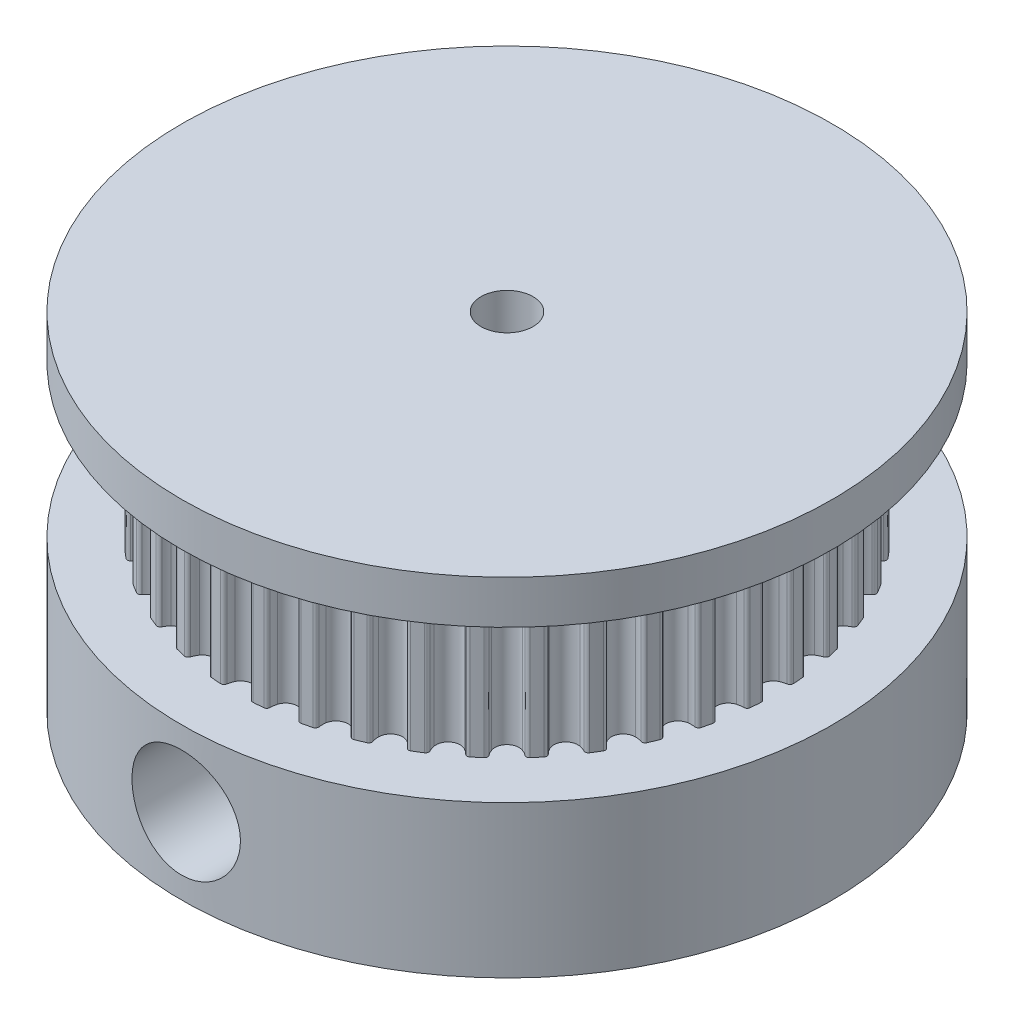
from build123d import *

# Parameters (mm, degrees)
GEAR_DEPTH              = 3.5
SKETCH2_R               = 15
SKETCH2_R_2             = 1.2
BASE_DEPTH              = 7
NUT_PASSTHROUGH_DEPTH   = 3.5
TOP_START               = 2
SKETCH9_R               = 15
TOP_DEPTH               = 2
SHAFT_HOLE_DEPTH        = 24.043437244
SKETCH10_R              = 1.4
SCREW_HOLE_DEPTH        = 24.669600757
SCREW_START             = 5
SKETCH10_3_R            = 2.5
SKETCH10_3_R_2          = 1.4
SCREW_COUNTERBORE_DEPTH = 19.669600928
CHAMFER2_SIZE           = 1.1
SKETCH14_R              = 1
BOSS_EXTRUDE1_DEPTH     = 10.5


with BuildPart() as part:
    # Sketch1 → Gear (new, symmetric)
    with BuildSketch(Plane(origin=(0, 0, 0), x_dir=(1, 0, 0), z_dir=(0, 1, 0))):
        with BuildLine():
            ThreePointArc((1.833722096, 11.57766566), (1.55639111, 11.707003084), (1.389763602, 11.963666129))
            ThreePointArc((1.389763602, 11.963666129), (1.356190139, 12.114322359), (1.346201315, 12.268350606))
            ThreePointArc((1.346201315, 12.268350606), (1.307933069, 12.370317587), (1.210767384, 12.419516709))
            ThreePointArc((1.210767384, 12.419516709), (0.979043623, 12.439928719), (0.746979624, 12.456017597))
            ThreePointArc((0.746979624, 12.456017597), (0.643313772, 12.42262426), (0.589565521, 12.327899134))
            ThreePointArc((0.589565521, 12.327899134), (0.55560435, 12.177329827), (0.498876404, 12.033780472))
            ThreePointArc((0.498876404, 12.033780472), (0.294149412, 11.80634366), (0, 11.721982719))
            ThreePointArc((0, 11.721982719), (-0.294149412, 11.80634366), (-0.498876404, 12.033780472))
            ThreePointArc((-0.498876404, 12.033780472), (-0.55560435, 12.177329827), (-0.589565521, 12.327899134))
            ThreePointArc((-0.589565521, 12.327899134), (-0.643313772, 12.42262426), (-0.746979624, 12.456017597))
            ThreePointArc((-0.746979624, 12.456017597), (-0.979043623, 12.439928719), (-1.210767384, 12.419516709))
            ThreePointArc((-1.210767384, 12.419516709), (-1.307933069, 12.370317587), (-1.346201315, 12.268350606))
            ThreePointArc((-1.346201315, 12.268350606), (-1.356190139, 12.114322359), (-1.389763602, 11.963666129))
            ThreePointArc((-1.389763602, 11.963666129), (-1.55639111, 11.707003084), (-1.833722096, 11.57766566))
            ThreePointArc((-1.833722096, 11.57766566), (-2.137446999, 11.614972872), (-2.375232419, 11.807583202))
            ThreePointArc((-2.375232419, 11.807583202), (-2.453718016, 11.940491021), (-2.510815297, 12.083893872))
            ThreePointArc((-2.510815297, 12.083893872), (-2.578720092, 12.169044696), (-2.686333515, 12.185809993))
            ThreePointArc((-2.686333515, 12.185809993), (-2.913023566, 12.133616388), (-3.138701281, 12.077206101))
            ThreePointArc((-3.138701281, 12.077206101), (-3.226974257, 12.01341264), (-3.248820207, 11.906714569))
            ThreePointArc((-3.248820207, 11.906714569), (-3.234590725, 11.75302007), (-3.244183017, 11.59896662))
            ThreePointArc((-3.244183017, 11.59896662), (-3.368608118, 11.319397239), (-3.622291868, 11.148268049))
            ThreePointArc((-3.622291868, 11.148268049), (-3.928113547, 11.137602905), (-4.193102328, 11.290644046))
            ThreePointArc((-4.193102328, 11.290644046), (-4.291413, 11.409637697), (-4.370240468, 11.542343038))
            ThreePointArc((-4.370240468, 11.542343038), (-4.450629766, 11.615822864), (-4.559540959, 11.615547305))
            ThreePointArc((-4.559540959, 11.615547305), (-4.7752752, 11.528534152), (-4.989349935, 11.437514597))
            ThreePointArc((-4.989349935, 11.437514597), (-5.066556628, 11.360697604), (-5.071442363, 11.251895704))
            ThreePointArc((-5.071442363, 11.251895704), (-5.033344953, 11.10231942), (-5.018719879, 10.948662059))
            ThreePointArc((-5.018719879, 10.948662059), (-5.097878813, 10.653070266), (-5.321668792, 10.444363079))
            ThreePointArc((-5.321668792, 10.444363079), (-5.622056903, 10.38598819), (-5.907724141, 10.495691763))
            ThreePointArc((-5.907724141, 10.495691763), (-6.023439154, 10.597841227), (-6.122055814, 10.716581412))
            ThreePointArc((-6.122055814, 10.716581412), (-6.212950164, 10.776580923), (-6.320477372, 10.759271292))
            ThreePointArc((-6.320477372, 10.759271292), (-6.519943711, 10.639581145), (-6.717144235, 10.516193525))
            ThreePointArc((-6.717144235, 10.516193525), (-6.781383561, 10.428244489), (-6.769188777, 10.320017823))
            ThreePointArc((-6.769188777, 10.320017823), (-6.708161524, 10.178242819), (-6.669679201, 10.028765101))
            ThreePointArc((-6.669679201, 10.028765101), (-6.701622814, 9.724429349), (-6.89000857, 9.483283227))
            ThreePointArc((-6.89000857, 9.483283227), (-7.17756656, 9.378635976), (-7.47687818, 9.442300715))
            ThreePointArc((-7.47687818, 9.442300715), (-7.607148246, 9.525090733), (-7.723125829, 9.626941986))
            ThreePointArc((-7.723125829, 9.626941986), (-7.822287109, 9.671983794), (-7.925782656, 9.638066311))
            ThreePointArc((-7.925782656, 9.638066311), (-8.10406957, 9.488646339), (-8.279540152, 9.335928867))
            ThreePointArc((-8.279540152, 9.335928867), (-8.329230324, 9.239013385), (-8.300255298, 9.134026853))
            ThreePointArc((-8.300255298, 9.134026853), (-8.217800894, 9.003544101), (-8.156408886, 8.861926663))
            ThreePointArc((-8.156408886, 8.861926663), (-8.140350619, 8.556340707), (-8.288693469, 8.288693469))
            ThreePointArc((-8.288693469, 8.288693469), (-8.556340707, 8.140350619), (-8.861926663, 8.156408886))
            ThreePointArc((-8.861926663, 8.156408886), (-9.003544101, 8.217800894), (-9.134026853, 8.300255298))
            ThreePointArc((-9.134026853, 8.300255298), (-9.239013385, 8.329230324), (-9.335928867, 8.279540152))
            ThreePointArc((-9.335928867, 8.279540152), (-9.488646339, 8.10406957), (-9.638066311, 7.925782656))
            ThreePointArc((-9.638066311, 7.925782656), (-9.671983794, 7.822287109), (-9.626941986, 7.723125829))
            ThreePointArc((-9.626941986, 7.723125829), (-9.525090733, 7.607148246), (-9.442300715, 7.47687818))
            ThreePointArc((-9.442300715, 7.47687818), (-9.378635976, 7.17756656), (-9.483283227, 6.89000857))
            ThreePointArc((-9.483283227, 6.89000857), (-9.724429349, 6.701622814), (-10.028765101, 6.669679201))
            ThreePointArc((-10.028765101, 6.669679201), (-10.178242819, 6.708161524), (-10.320017823, 6.769188777))
            ThreePointArc((-10.320017823, 6.769188777), (-10.428244489, 6.781383561), (-10.516193525, 6.717144235))
            ThreePointArc((-10.516193525, 6.717144235), (-10.639581145, 6.519943711), (-10.759271292, 6.320477372))
            ThreePointArc((-10.759271292, 6.320477372), (-10.776580923, 6.212950164), (-10.716581412, 6.122055814))
            ThreePointArc((-10.716581412, 6.122055814), (-10.597841227, 6.023439154), (-10.495691763, 5.907724141))
            ThreePointArc((-10.495691763, 5.907724141), (-10.38598819, 5.622056903), (-10.444363079, 5.321668792))
            ThreePointArc((-10.444363079, 5.321668792), (-10.653070266, 5.097878813), (-10.948662059, 5.018719879))
            ThreePointArc((-10.948662059, 5.018719879), (-11.10231942, 5.033344953), (-11.251895704, 5.071442363))
            ThreePointArc((-11.251895704, 5.071442363), (-11.360697604, 5.066556628), (-11.437514597, 4.989349935))
            ThreePointArc((-11.437514597, 4.989349935), (-11.528534152, 4.7752752), (-11.615547305, 4.559540959))
            ThreePointArc((-11.615547305, 4.559540959), (-11.615822864, 4.450629766), (-11.542343038, 4.370240468))
            ThreePointArc((-11.542343038, 4.370240468), (-11.409637697, 4.291413), (-11.290644046, 4.193102328))
            ThreePointArc((-11.290644046, 4.193102328), (-11.137602905, 3.928113547), (-11.148268049, 3.622291868))
            ThreePointArc((-11.148268049, 3.622291868), (-11.319397239, 3.368608118), (-11.59896662, 3.244183017))
            ThreePointArc((-11.59896662, 3.244183017), (-11.75302007, 3.234590725), (-11.906714569, 3.248820207))
            ThreePointArc((-11.906714569, 3.248820207), (-12.01341264, 3.226974257), (-12.077206101, 3.138701281))
            ThreePointArc((-12.077206101, 3.138701281), (-12.133616388, 2.913023566), (-12.185809993, 2.686333515))
            ThreePointArc((-12.185809993, 2.686333515), (-12.169044696, 2.578720092), (-12.083893872, 2.510815297))
            ThreePointArc((-12.083893872, 2.510815297), (-11.940491021, 2.453718016), (-11.807583202, 2.375232419))
            ThreePointArc((-11.807583202, 2.375232419), (-11.614972872, 2.137446999), (-11.57766566, 1.833722096))
            ThreePointArc((-11.57766566, 1.833722096), (-11.707003084, 1.55639111), (-11.963666129, 1.389763602))
            ThreePointArc((-11.963666129, 1.389763602), (-12.114322359, 1.356190139), (-12.268350606, 1.346201315))
            ThreePointArc((-12.268350606, 1.346201315), (-12.370317587, 1.307933069), (-12.419516709, 1.210767384))
            ThreePointArc((-12.419516709, 1.210767384), (-12.439928719, 0.979043623), (-12.456017597, 0.746979624))
            ThreePointArc((-12.456017597, 0.746979624), (-12.42262426, 0.643313772), (-12.327899134, 0.589565521))
            ThreePointArc((-12.327899134, 0.589565521), (-12.177329827, 0.55560435), (-12.033780472, 0.498876404))
            ThreePointArc((-12.033780472, 0.498876404), (-11.80634366, 0.294149412), (-11.721982719, 0))
            ThreePointArc((-11.721982719, 0), (-11.80634366, -0.294149412), (-12.033780472, -0.498876404))
            ThreePointArc((-12.033780472, -0.498876404), (-12.177329827, -0.55560435), (-12.327899134, -0.589565521))
            ThreePointArc((-12.327899134, -0.589565521), (-12.42262426, -0.643313772), (-12.456017597, -0.746979624))
            ThreePointArc((-12.456017597, -0.746979624), (-12.439928719, -0.979043623), (-12.419516709, -1.210767384))
            ThreePointArc((-12.419516709, -1.210767384), (-12.370317587, -1.307933069), (-12.268350606, -1.346201315))
            ThreePointArc((-12.268350606, -1.346201315), (-12.114322359, -1.356190139), (-11.963666129, -1.389763602))
            ThreePointArc((-11.963666129, -1.389763602), (-11.707003084, -1.55639111), (-11.57766566, -1.833722096))
            ThreePointArc((-11.57766566, -1.833722096), (-11.614972872, -2.137446999), (-11.807583202, -2.375232419))
            ThreePointArc((-11.807583202, -2.375232419), (-11.940491021, -2.453718016), (-12.083893872, -2.510815297))
            ThreePointArc((-12.083893872, -2.510815297), (-12.169044696, -2.578720092), (-12.185809993, -2.686333515))
            ThreePointArc((-12.185809993, -2.686333515), (-12.133616388, -2.913023566), (-12.077206101, -3.138701281))
            ThreePointArc((-12.077206101, -3.138701281), (-12.01341264, -3.226974257), (-11.906714569, -3.248820207))
            ThreePointArc((-11.906714569, -3.248820207), (-11.75302007, -3.234590725), (-11.59896662, -3.244183017))
            ThreePointArc((-11.59896662, -3.244183017), (-11.319397239, -3.368608118), (-11.148268049, -3.622291868))
            ThreePointArc((-11.148268049, -3.622291868), (-11.137602905, -3.928113547), (-11.290644046, -4.193102328))
            ThreePointArc((-11.290644046, -4.193102328), (-11.409637697, -4.291413), (-11.542343038, -4.370240468))
            ThreePointArc((-11.542343038, -4.370240468), (-11.615822864, -4.450629766), (-11.615547305, -4.559540959))
            ThreePointArc((-11.615547305, -4.559540959), (-11.528534152, -4.7752752), (-11.437514597, -4.989349935))
            ThreePointArc((-11.437514597, -4.989349935), (-11.360697604, -5.066556628), (-11.251895704, -5.071442363))
            ThreePointArc((-11.251895704, -5.071442363), (-11.10231942, -5.033344953), (-10.948662059, -5.018719879))
            ThreePointArc((-10.948662059, -5.018719879), (-10.653070266, -5.097878813), (-10.444363079, -5.321668792))
            ThreePointArc((-10.444363079, -5.321668792), (-10.38598819, -5.622056903), (-10.495691763, -5.907724141))
            ThreePointArc((-10.495691763, -5.907724141), (-10.597841227, -6.023439154), (-10.716581412, -6.122055814))
            ThreePointArc((-10.716581412, -6.122055814), (-10.776580923, -6.212950164), (-10.759271292, -6.320477372))
            ThreePointArc((-10.759271292, -6.320477372), (-10.639581145, -6.519943711), (-10.516193525, -6.717144235))
            ThreePointArc((-10.516193525, -6.717144235), (-10.428244489, -6.781383561), (-10.320017823, -6.769188777))
            ThreePointArc((-10.320017823, -6.769188777), (-10.178242819, -6.708161524), (-10.028765101, -6.669679201))
            ThreePointArc((-10.028765101, -6.669679201), (-9.724429349, -6.701622814), (-9.483283227, -6.89000857))
            ThreePointArc((-9.483283227, -6.89000857), (-9.378635976, -7.17756656), (-9.442300715, -7.47687818))
            ThreePointArc((-9.442300715, -7.47687818), (-9.525090733, -7.607148246), (-9.626941986, -7.723125829))
            ThreePointArc((-9.626941986, -7.723125829), (-9.671983794, -7.822287109), (-9.638066311, -7.925782656))
            ThreePointArc((-9.638066311, -7.925782656), (-9.488646339, -8.10406957), (-9.335928867, -8.279540152))
            ThreePointArc((-9.335928867, -8.279540152), (-9.239013385, -8.329230324), (-9.134026853, -8.300255298))
            ThreePointArc((-9.134026853, -8.300255298), (-9.003544101, -8.217800894), (-8.861926663, -8.156408886))
            ThreePointArc((-8.861926663, -8.156408886), (-8.556340707, -8.140350619), (-8.288693469, -8.288693469))
            ThreePointArc((-8.288693469, -8.288693469), (-8.140350619, -8.556340707), (-8.156408886, -8.861926663))
            ThreePointArc((-8.156408886, -8.861926663), (-8.217800894, -9.003544101), (-8.300255298, -9.134026853))
            ThreePointArc((-8.300255298, -9.134026853), (-8.329230324, -9.239013385), (-8.279540152, -9.335928867))
            ThreePointArc((-8.279540152, -9.335928867), (-8.10406957, -9.488646339), (-7.925782656, -9.638066311))
            ThreePointArc((-7.925782656, -9.638066311), (-7.822287109, -9.671983794), (-7.723125829, -9.626941986))
            ThreePointArc((-7.723125829, -9.626941986), (-7.607148246, -9.525090733), (-7.47687818, -9.442300715))
            ThreePointArc((-7.47687818, -9.442300715), (-7.17756656, -9.378635976), (-6.89000857, -9.483283227))
            ThreePointArc((-6.89000857, -9.483283227), (-6.701622814, -9.724429349), (-6.669679201, -10.028765101))
            ThreePointArc((-6.669679201, -10.028765101), (-6.708161524, -10.178242819), (-6.769188777, -10.320017823))
            ThreePointArc((-6.769188777, -10.320017823), (-6.781383561, -10.428244489), (-6.717144235, -10.516193525))
            ThreePointArc((-6.717144235, -10.516193525), (-6.519943711, -10.639581145), (-6.320477372, -10.759271292))
            ThreePointArc((-6.320477372, -10.759271292), (-6.212950164, -10.776580923), (-6.122055814, -10.716581412))
            ThreePointArc((-6.122055814, -10.716581412), (-6.023439154, -10.597841227), (-5.907724141, -10.495691763))
            ThreePointArc((-5.907724141, -10.495691763), (-5.622056903, -10.38598819), (-5.321668792, -10.444363079))
            ThreePointArc((-5.321668792, -10.444363079), (-5.097878813, -10.653070266), (-5.018719879, -10.948662059))
            ThreePointArc((-5.018719879, -10.948662059), (-5.033344953, -11.10231942), (-5.071442363, -11.251895704))
            ThreePointArc((-5.071442363, -11.251895704), (-5.066556628, -11.360697604), (-4.989349935, -11.437514597))
            ThreePointArc((-4.989349935, -11.437514597), (-4.7752752, -11.528534152), (-4.559540959, -11.615547305))
            ThreePointArc((-4.559540959, -11.615547305), (-4.450629766, -11.615822864), (-4.370240468, -11.542343038))
            ThreePointArc((-4.370240468, -11.542343038), (-4.291413, -11.409637697), (-4.193102328, -11.290644046))
            ThreePointArc((-4.193102328, -11.290644046), (-3.928113547, -11.137602905), (-3.622291868, -11.148268049))
            ThreePointArc((-3.622291868, -11.148268049), (-3.368608118, -11.319397239), (-3.244183017, -11.59896662))
            ThreePointArc((-3.244183017, -11.59896662), (-3.234590725, -11.75302007), (-3.248820207, -11.906714569))
            ThreePointArc((-3.248820207, -11.906714569), (-3.226974257, -12.01341264), (-3.138701281, -12.077206101))
            ThreePointArc((-3.138701281, -12.077206101), (-2.913023566, -12.133616388), (-2.686333515, -12.185809993))
            ThreePointArc((-2.686333515, -12.185809993), (-2.578720092, -12.169044696), (-2.510815297, -12.083893872))
            ThreePointArc((-2.510815297, -12.083893872), (-2.453718016, -11.940491021), (-2.375232419, -11.807583202))
            ThreePointArc((-2.375232419, -11.807583202), (-2.137446999, -11.614972872), (-1.833722096, -11.57766566))
            ThreePointArc((-1.833722096, -11.57766566), (-1.55639111, -11.707003084), (-1.389763602, -11.963666129))
            ThreePointArc((-1.389763602, -11.963666129), (-1.356190139, -12.114322359), (-1.346201315, -12.268350606))
            ThreePointArc((-1.346201315, -12.268350606), (-1.307933069, -12.370317587), (-1.210767384, -12.419516709))
            ThreePointArc((-1.210767384, -12.419516709), (-0.979043623, -12.439928719), (-0.746979624, -12.456017597))
            ThreePointArc((-0.746979624, -12.456017597), (-0.643313772, -12.42262426), (-0.589565521, -12.327899134))
            ThreePointArc((-0.589565521, -12.327899134), (-0.55560435, -12.177329827), (-0.498876404, -12.033780472))
            ThreePointArc((-0.498876404, -12.033780472), (-0.294149412, -11.80634366), (0, -11.721982719))
            ThreePointArc((0, -11.721982719), (0.294149412, -11.80634366), (0.498876404, -12.033780472))
            ThreePointArc((0.498876404, -12.033780472), (0.55560435, -12.177329827), (0.589565521, -12.327899134))
            ThreePointArc((0.589565521, -12.327899134), (0.643313772, -12.42262426), (0.746979624, -12.456017597))
            ThreePointArc((0.746979624, -12.456017597), (0.979043623, -12.439928719), (1.210767384, -12.419516709))
            ThreePointArc((1.210767384, -12.419516709), (1.307933069, -12.370317587), (1.346201315, -12.268350606))
            ThreePointArc((1.346201315, -12.268350606), (1.356190139, -12.114322359), (1.389763602, -11.963666129))
            ThreePointArc((1.389763602, -11.963666129), (1.55639111, -11.707003084), (1.833722096, -11.57766566))
            ThreePointArc((1.833722096, -11.57766566), (2.137446999, -11.614972872), (2.375232419, -11.807583202))
            ThreePointArc((2.375232419, -11.807583202), (2.453718016, -11.940491021), (2.510815297, -12.083893872))
            ThreePointArc((2.510815297, -12.083893872), (2.578720092, -12.169044696), (2.686333515, -12.185809993))
            ThreePointArc((2.686333515, -12.185809993), (2.913023566, -12.133616388), (3.138701281, -12.077206101))
            ThreePointArc((3.138701281, -12.077206101), (3.226974257, -12.01341264), (3.248820207, -11.906714569))
            ThreePointArc((3.248820207, -11.906714569), (3.234590725, -11.75302007), (3.244183017, -11.59896662))
            ThreePointArc((3.244183017, -11.59896662), (3.368608118, -11.319397239), (3.622291868, -11.148268049))
            ThreePointArc((3.622291868, -11.148268049), (3.928113547, -11.137602905), (4.193102328, -11.290644046))
            ThreePointArc((4.193102328, -11.290644046), (4.291413, -11.409637697), (4.370240468, -11.542343038))
            ThreePointArc((4.370240468, -11.542343038), (4.450629766, -11.615822864), (4.559540959, -11.615547305))
            ThreePointArc((4.559540959, -11.615547305), (4.7752752, -11.528534152), (4.989349935, -11.437514597))
            ThreePointArc((4.989349935, -11.437514597), (5.066556628, -11.360697604), (5.071442363, -11.251895704))
            ThreePointArc((5.071442363, -11.251895704), (5.033344953, -11.10231942), (5.018719879, -10.948662059))
            ThreePointArc((5.018719879, -10.948662059), (5.097878813, -10.653070266), (5.321668792, -10.444363079))
            ThreePointArc((5.321668792, -10.444363079), (5.622056903, -10.38598819), (5.907724141, -10.495691763))
            ThreePointArc((5.907724141, -10.495691763), (6.023439154, -10.597841227), (6.122055814, -10.716581412))
            ThreePointArc((6.122055814, -10.716581412), (6.212950164, -10.776580923), (6.320477372, -10.759271292))
            ThreePointArc((6.320477372, -10.759271292), (6.519943711, -10.639581145), (6.717144235, -10.516193525))
            ThreePointArc((6.717144235, -10.516193525), (6.781383561, -10.428244489), (6.769188777, -10.320017823))
            ThreePointArc((6.769188777, -10.320017823), (6.708161524, -10.178242819), (6.669679201, -10.028765101))
            ThreePointArc((6.669679201, -10.028765101), (6.701622814, -9.724429349), (6.89000857, -9.483283227))
            ThreePointArc((6.89000857, -9.483283227), (7.17756656, -9.378635976), (7.47687818, -9.442300715))
            ThreePointArc((7.47687818, -9.442300715), (7.607148246, -9.525090733), (7.723125829, -9.626941986))
            ThreePointArc((7.723125829, -9.626941986), (7.822287109, -9.671983794), (7.925782656, -9.638066311))
            ThreePointArc((7.925782656, -9.638066311), (8.10406957, -9.488646339), (8.279540152, -9.335928867))
            ThreePointArc((8.279540152, -9.335928867), (8.329230324, -9.239013385), (8.300255298, -9.134026853))
            ThreePointArc((8.300255298, -9.134026853), (8.217800894, -9.003544101), (8.156408886, -8.861926663))
            ThreePointArc((8.156408886, -8.861926663), (8.140350619, -8.556340707), (8.288693469, -8.288693469))
            ThreePointArc((8.288693469, -8.288693469), (8.556340707, -8.140350619), (8.861926663, -8.156408886))
            ThreePointArc((8.861926663, -8.156408886), (9.003544101, -8.217800894), (9.134026853, -8.300255298))
            ThreePointArc((9.134026853, -8.300255298), (9.239013385, -8.329230324), (9.335928867, -8.279540152))
            ThreePointArc((9.335928867, -8.279540152), (9.488646339, -8.10406957), (9.638066311, -7.925782656))
            ThreePointArc((9.638066311, -7.925782656), (9.671983794, -7.822287109), (9.626941986, -7.723125829))
            ThreePointArc((9.626941986, -7.723125829), (9.525090733, -7.607148246), (9.442300715, -7.47687818))
            ThreePointArc((9.442300715, -7.47687818), (9.378635976, -7.17756656), (9.483283227, -6.89000857))
            ThreePointArc((9.483283227, -6.89000857), (9.724429349, -6.701622814), (10.028765101, -6.669679201))
            ThreePointArc((10.028765101, -6.669679201), (10.178242819, -6.708161524), (10.320017823, -6.769188777))
            ThreePointArc((10.320017823, -6.769188777), (10.428244489, -6.781383561), (10.516193525, -6.717144235))
            ThreePointArc((10.516193525, -6.717144235), (10.639581145, -6.519943711), (10.759271292, -6.320477372))
            ThreePointArc((10.759271292, -6.320477372), (10.776580923, -6.212950164), (10.716581412, -6.122055814))
            ThreePointArc((10.716581412, -6.122055814), (10.597841227, -6.023439154), (10.495691763, -5.907724141))
            ThreePointArc((10.495691763, -5.907724141), (10.38598819, -5.622056903), (10.444363079, -5.321668792))
            ThreePointArc((10.444363079, -5.321668792), (10.653070266, -5.097878813), (10.948662059, -5.018719879))
            ThreePointArc((10.948662059, -5.018719879), (11.10231942, -5.033344953), (11.251895704, -5.071442363))
            ThreePointArc((11.251895704, -5.071442363), (11.360697604, -5.066556628), (11.437514597, -4.989349935))
            ThreePointArc((11.437514597, -4.989349935), (11.528534152, -4.7752752), (11.615547305, -4.559540959))
            ThreePointArc((11.615547305, -4.559540959), (11.615822864, -4.450629766), (11.542343038, -4.370240468))
            ThreePointArc((11.542343038, -4.370240468), (11.409637697, -4.291413), (11.290644046, -4.193102328))
            ThreePointArc((11.290644046, -4.193102328), (11.137602905, -3.928113547), (11.148268049, -3.622291868))
            ThreePointArc((11.148268049, -3.622291868), (11.319397239, -3.368608118), (11.59896662, -3.244183017))
            ThreePointArc((11.59896662, -3.244183017), (11.75302007, -3.234590725), (11.906714569, -3.248820207))
            ThreePointArc((11.906714569, -3.248820207), (12.01341264, -3.226974257), (12.077206101, -3.138701281))
            ThreePointArc((12.077206101, -3.138701281), (12.133616388, -2.913023566), (12.185809993, -2.686333515))
            ThreePointArc((12.185809993, -2.686333515), (12.169044696, -2.578720092), (12.083893872, -2.510815297))
            ThreePointArc((12.083893872, -2.510815297), (11.940491021, -2.453718016), (11.807583202, -2.375232419))
            ThreePointArc((11.807583202, -2.375232419), (11.614972872, -2.137446999), (11.57766566, -1.833722096))
            ThreePointArc((11.57766566, -1.833722096), (11.707003084, -1.55639111), (11.963666129, -1.389763602))
            ThreePointArc((11.963666129, -1.389763602), (12.114322359, -1.356190139), (12.268350606, -1.346201315))
            ThreePointArc((12.268350606, -1.346201315), (12.370317587, -1.307933069), (12.419516709, -1.210767384))
            ThreePointArc((12.419516709, -1.210767384), (12.439928719, -0.979043623), (12.456017597, -0.746979624))
            ThreePointArc((12.456017597, -0.746979624), (12.42262426, -0.643313772), (12.327899134, -0.589565521))
            ThreePointArc((12.327899134, -0.589565521), (12.177329827, -0.55560435), (12.033780472, -0.498876404))
            ThreePointArc((12.033780472, -0.498876404), (11.80634366, -0.294149412), (11.721982719, 0))
            ThreePointArc((11.721982719, 0), (11.80634366, 0.294149412), (12.033780472, 0.498876404))
            ThreePointArc((12.033780472, 0.498876404), (12.177329827, 0.55560435), (12.327899134, 0.589565521))
            ThreePointArc((12.327899134, 0.589565521), (12.42262426, 0.643313772), (12.456017597, 0.746979624))
            ThreePointArc((12.456017597, 0.746979624), (12.439928719, 0.979043623), (12.419516709, 1.210767384))
            ThreePointArc((12.419516709, 1.210767384), (12.370317587, 1.307933069), (12.268350606, 1.346201315))
            ThreePointArc((12.268350606, 1.346201315), (12.114322359, 1.356190139), (11.963666129, 1.389763602))
            ThreePointArc((11.963666129, 1.389763602), (11.707003084, 1.55639111), (11.57766566, 1.833722096))
            ThreePointArc((11.57766566, 1.833722096), (11.614972872, 2.137446999), (11.807583202, 2.375232419))
            ThreePointArc((11.807583202, 2.375232419), (11.940491021, 2.453718016), (12.083893872, 2.510815297))
            ThreePointArc((12.083893872, 2.510815297), (12.169044696, 2.578720092), (12.185809993, 2.686333515))
            ThreePointArc((12.185809993, 2.686333515), (12.133616388, 2.913023566), (12.077206101, 3.138701281))
            ThreePointArc((12.077206101, 3.138701281), (12.01341264, 3.226974257), (11.906714569, 3.248820207))
            ThreePointArc((11.906714569, 3.248820207), (11.75302007, 3.234590725), (11.59896662, 3.244183017))
            ThreePointArc((11.59896662, 3.244183017), (11.319397239, 3.368608118), (11.148268049, 3.622291868))
            ThreePointArc((11.148268049, 3.622291868), (11.137602905, 3.928113547), (11.290644046, 4.193102328))
            ThreePointArc((11.290644046, 4.193102328), (11.409637697, 4.291413), (11.542343038, 4.370240468))
            ThreePointArc((11.542343038, 4.370240468), (11.615822864, 4.450629766), (11.615547305, 4.559540959))
            ThreePointArc((11.615547305, 4.559540959), (11.528534152, 4.7752752), (11.437514597, 4.989349935))
            ThreePointArc((11.437514597, 4.989349935), (11.360697604, 5.066556628), (11.251895704, 5.071442363))
            ThreePointArc((11.251895704, 5.071442363), (11.10231942, 5.033344953), (10.948662059, 5.018719879))
            ThreePointArc((10.948662059, 5.018719879), (10.653070266, 5.097878813), (10.444363079, 5.321668792))
            ThreePointArc((10.444363079, 5.321668792), (10.38598819, 5.622056903), (10.495691763, 5.907724141))
            ThreePointArc((10.495691763, 5.907724141), (10.597841227, 6.023439154), (10.716581412, 6.122055814))
            ThreePointArc((10.716581412, 6.122055814), (10.776580923, 6.212950164), (10.759271292, 6.320477372))
            ThreePointArc((10.759271292, 6.320477372), (10.639581145, 6.519943711), (10.516193525, 6.717144235))
            ThreePointArc((10.516193525, 6.717144235), (10.428244489, 6.781383561), (10.320017823, 6.769188777))
            ThreePointArc((10.320017823, 6.769188777), (10.178242819, 6.708161524), (10.028765101, 6.669679201))
            ThreePointArc((10.028765101, 6.669679201), (9.724429349, 6.701622814), (9.483283227, 6.89000857))
            ThreePointArc((9.483283227, 6.89000857), (9.378635976, 7.17756656), (9.442300715, 7.47687818))
            ThreePointArc((9.442300715, 7.47687818), (9.525090733, 7.607148246), (9.626941986, 7.723125829))
            ThreePointArc((9.626941986, 7.723125829), (9.671983794, 7.822287109), (9.638066311, 7.925782656))
            ThreePointArc((9.638066311, 7.925782656), (9.488646339, 8.10406957), (9.335928867, 8.279540152))
            ThreePointArc((9.335928867, 8.279540152), (9.239013385, 8.329230324), (9.134026853, 8.300255298))
            ThreePointArc((9.134026853, 8.300255298), (9.003544101, 8.217800894), (8.861926663, 8.156408886))
            ThreePointArc((8.861926663, 8.156408886), (8.556340707, 8.140350619), (8.288693469, 8.288693469))
            ThreePointArc((8.288693469, 8.288693469), (8.140350619, 8.556340707), (8.156408886, 8.861926663))
            ThreePointArc((8.156408886, 8.861926663), (8.217800894, 9.003544101), (8.300255298, 9.134026853))
            ThreePointArc((8.300255298, 9.134026853), (8.329230324, 9.239013385), (8.279540152, 9.335928867))
            ThreePointArc((8.279540152, 9.335928867), (8.10406957, 9.488646339), (7.925782656, 9.638066311))
            ThreePointArc((7.925782656, 9.638066311), (7.822287109, 9.671983794), (7.723125829, 9.626941986))
            ThreePointArc((7.723125829, 9.626941986), (7.607148246, 9.525090733), (7.47687818, 9.442300715))
            ThreePointArc((7.47687818, 9.442300715), (7.17756656, 9.378635976), (6.89000857, 9.483283227))
            ThreePointArc((6.89000857, 9.483283227), (6.701622814, 9.724429349), (6.669679201, 10.028765101))
            ThreePointArc((6.669679201, 10.028765101), (6.708161524, 10.178242819), (6.769188777, 10.320017823))
            ThreePointArc((6.769188777, 10.320017823), (6.781383561, 10.428244489), (6.717144235, 10.516193525))
            ThreePointArc((6.717144235, 10.516193525), (6.519943711, 10.639581145), (6.320477372, 10.759271292))
            ThreePointArc((6.320477372, 10.759271292), (6.212950164, 10.776580923), (6.122055814, 10.716581412))
            ThreePointArc((6.122055814, 10.716581412), (6.023439154, 10.597841227), (5.907724141, 10.495691763))
            ThreePointArc((5.907724141, 10.495691763), (5.622056903, 10.38598819), (5.321668792, 10.444363079))
            ThreePointArc((5.321668792, 10.444363079), (5.097878813, 10.653070266), (5.018719879, 10.948662059))
            ThreePointArc((5.018719879, 10.948662059), (5.033344953, 11.10231942), (5.071442363, 11.251895704))
            ThreePointArc((5.071442363, 11.251895704), (5.066556628, 11.360697604), (4.989349935, 11.437514597))
            ThreePointArc((4.989349935, 11.437514597), (4.7752752, 11.528534152), (4.559540959, 11.615547305))
            ThreePointArc((4.559540959, 11.615547305), (4.450629766, 11.615822864), (4.370240468, 11.542343038))
            ThreePointArc((4.370240468, 11.542343038), (4.291413, 11.409637697), (4.193102328, 11.290644046))
            ThreePointArc((4.193102328, 11.290644046), (3.928113547, 11.137602905), (3.622291868, 11.148268049))
            ThreePointArc((3.622291868, 11.148268049), (3.368608118, 11.319397239), (3.244183017, 11.59896662))
            ThreePointArc((3.244183017, 11.59896662), (3.234590725, 11.75302007), (3.248820207, 11.906714569))
            ThreePointArc((3.248820207, 11.906714569), (3.226974257, 12.01341264), (3.138701281, 12.077206101))
            ThreePointArc((3.138701281, 12.077206101), (2.913023566, 12.133616388), (2.686333515, 12.185809993))
            ThreePointArc((2.686333515, 12.185809993), (2.578720092, 12.169044696), (2.510815297, 12.083893872))
            ThreePointArc((2.510815297, 12.083893872), (2.453718016, 11.940491021), (2.375232419, 11.807583202))
            ThreePointArc((2.375232419, 11.807583202), (2.137446999, 11.614972872), (1.833722096, 11.57766566))
        make_face()
    extrude(amount=GEAR_DEPTH, both=True)

    # Sketch2 → Base (add)
    with BuildSketch(Plane.XZ.offset(3.5)):
        with Locations(Location((0, 0, 0), (0, 0, 270))):
            Circle(SKETCH2_R)
        with Locations(Location((0, 0, 0), (0, 0, 270))):
            Circle(SKETCH2_R_2, mode=Mode.SUBTRACT)
    extrude(amount=BASE_DEPTH)

    # Sketch3 → Nut Passthrough (cut)
    with BuildSketch(Plane.XY):
        Polygon((2.65, -8.529978213), (0, -10.059956427), (-2.65, -8.529978213), (-2.65, -10.5), (2.65, -10.5), align=None)
        Polygon((-2.65, -5.470021787), (-2.65, -8.529978213), (0, -10.059956427), (2.65, -8.529978213), (2.65, -5.470021787), (0, -3.940043573), align=None)
    extrude(amount=NUT_PASSTHROUGH_DEPTH, mode=Mode.SUBTRACT)

    # Sketch9 → Top (add)
    with BuildSketch(Plane(origin=(0, 3.5, 0), x_dir=(1, 0, 0), z_dir=(0, 1, 0)).offset(TOP_START)):
        with Locations(Location((0, 0, 0), (0, 0, 90))):
            Circle(SKETCH9_R)
    extrude(amount=-TOP_DEPTH)

    # Sketch2<4> → Shaft Hole (cut, through all)
    with BuildSketch(Plane.XZ.offset(3.5)):
        with BuildLine():
            ThreePointArc((1.2, 0), (0, 1.2), (-1.2, 0))
            Line((-1.2, 0), (1.2, 0))
        make_face()
        with BuildLine():
            Line((1.2, 0), (-1.2, 0))
            ThreePointArc((-1.2, 0), (0, -1.2), (1.2, 0))
        make_face()
    extrude(amount=-SHAFT_HOLE_DEPTH, mode=Mode.SUBTRACT)

    # Sketch10 → Screw Hole (cut, through all)
    with BuildSketch(Plane.XY):
        with Locations(Location((0, -7, 0), (0, 0, 270))):
            Circle(SKETCH10_R)
    extrude(amount=SCREW_HOLE_DEPTH, mode=Mode.SUBTRACT)

    # Sketch10<3> → Screw Counterbore (cut, through all)
    with BuildSketch(Plane.XY.offset(SCREW_START)):
        with Locations(Location((0, -7, 0), (0, 0, 270))):
            Circle(SKETCH10_3_R)
        with Locations((0, -7)):
            Circle(SKETCH10_3_R_2, mode=Mode.SUBTRACT)
    extrude(amount=SCREW_COUNTERBORE_DEPTH, mode=Mode.SUBTRACT)

    # Chamfer2
    chamfer2_edges = [part.edges().sort_by_distance(p)[0] for p in [
        (0, -4.5, 5),
    ]]
    chamfer(chamfer2_edges, length=CHAMFER2_SIZE - 0.0001)  # a hair under: the kernel refuses the full size


with BuildPart() as body_2:
    # Sketch14 → Boss-Extrude1 (new body)
    with BuildSketch(Plane(origin=(0, 0, 0), x_dir=(1, 0, 0), z_dir=(0, 1, 0))):
        with Locations(Location((0, 0, 0), (0, 0, 270))):
            Circle(SKETCH14_R)
    extrude(amount=-BOSS_EXTRUDE1_DEPTH)


solid = Compound([part.part, body_2.part])
